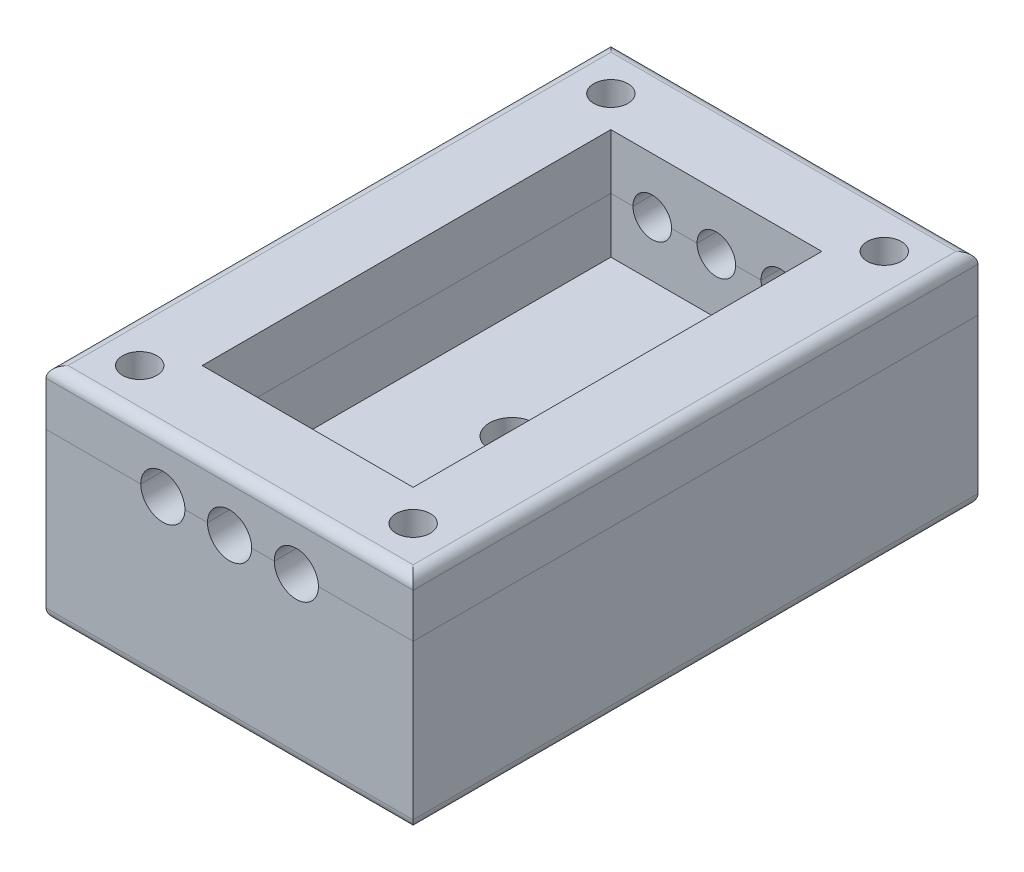
from build123d import *

# Parameters (mm, degrees)
BOSS_EXTRU_1_DEPTH           = 20
CONG_1_R                     = 0.5
CONG_2_R                     = 1
ESQUISSE3_W                  = 33.24213562373096
ESQUISSE3_H                  = 51.142135623730944
ESQUISSE3_R                  = 1.5499999999999992
ESQUISSE3_R_2                = 1.5499999999999898
ESQUISSE3_W_2                = 19.1
ESQUISSE3_H_2                = 37
BOSS_EXTRU_2_DEPTH           = 10
ESQUISSE3_3_W                = 33.24213562373096
ESQUISSE3_3_H                = 51.142135623730944
ESQUISSE3_3_R                = 1.5499999999999992
ESQUISSE3_3_R_2              = 1.5499999999999898
ESQUISSE3_3_W_2              = 19.1
ESQUISSE3_3_H_2              = 37
BOSS_EXTRU_4_DEPTH           = 20
TROUS_MOTEUR_REACH           = 57.899
ESQUISSE8_R                  = 1.7500000000000038
ESQUISSE8_R_2                = 1.7500000000000027
ENL_V_MAT_EXTRU_1_DEPTH      = 50.47483724416424
TROUS_CABLES_PUISSANCE_REACH = 57.899
ESQUISSE9_R                  = 2
ESQUISSE9_R_2                = 2.000000000000005
ESQUISSE9_R_3                = 2.0000000000000053
ENL_V_MAT_EXTRU_4_REACH      = 42.946
ESQUISSE10_R                 = 2.05
CONG_3_R                     = 1
FRACTIONNER1_SURFACE_1_BACK  = 65.715
FRACTIONNER1_SURFACE_1_DEPTH = 131.43
FRACTIONNER1_SURFACE_2_BACK  = 65.715
FRACTIONNER1_SURFACE_2_DEPTH = 131.43


with BuildPart() as part:
    # Esquisse1 → Boss.-Extru.1 (new body)
    with BuildSketch(Plane.XY):
        Polygon((-1.176e-14, 10.103135382441117), (-2.578e-14, 4.840000000000001), (3.5, 4.840000000000001), (5.71, 6.983135382441116), (5.71, 8.483135382441116), (2.95, 8.483135382441116), (2.95, 10.103135382441117), align=None)
        Polygon((-3.5, 4.840000000000001), (-2.576e-14, 4.840000000000001), (-1.176e-14, 10.103135382441117), (-2.95, 10.103135382441117), (-2.95, 8.483135382441116), (-5.71, 8.483135382441116), (-5.71, 6.983135382441116), align=None)
    extrude(amount=-BOSS_EXTRU_1_DEPTH)

    # Congé1
    cong_1_edges = [part.edges().sort_by_distance(p)[0] for p in [
        (5.71, 7.733135382441116, 0),
        (4.605, 5.911567691220558, 0),
        (0, 4.840000000000001, 0),
        (-4.605, 5.911567691220558, 0),
        (-5.71, 7.733135382441116, 0),
        (-5.71, 7.733135382441116, -20),
        (-4.605, 5.911567691220558, -20),
        (0, 4.840000000000001, -20),
        (4.605, 5.911567691220558, -20),
        (5.71, 7.733135382441116, -20),
    ]]
    fillet(cong_1_edges, radius=CONG_1_R)

    # Congé2
    # the kernel refuses this fillet: 1 mm, written as the material it takes off along each edge
    with BuildSketch(Plane(origin=(4.71, 7.4063748668930085, -20), x_dir=(1, 0, 0), z_dir=(0, 1, 0))) as cong_2_piece_1:
        with BuildLine():
            CenterArc((0.5, -0.5), 0.5, 0, 90)
            Line((1, -0.5), (1, 0))
            Line((1, 0), (0.5, 0))
        make_face()
    revolve(axis=Axis((4.71, 7.4063748668930085, -20), (0, 0, -1)), revolution_arc=45.87999999999987, mode=Mode.SUBTRACT)
    with BuildSketch(Plane(origin=(-4.710000000000001, 7.40637486689301, -20), x_dir=(-0.6961634275566162, -0.717883334625219, 0), z_dir=(0.717883334625219, -0.6961634275566162, 0))) as cong_2_piece_2:
        with BuildLine():
            CenterArc((0.5, -0.5), 0.5, 0, 90)
            Line((1, -0.5), (1, 0))
            Line((1, 0), (0.5, 0))
        make_face()
    revolve(axis=Axis((-4.710000000000001, 7.40637486689301, -20), (0, 0, -1)), revolution_arc=45.87999999999987, mode=Mode.SUBTRACT)
    with BuildSketch(Plane(origin=(4.71, 7.4063748668930085, 0), x_dir=(0.6961634275566162, -0.717883334625219, 0), z_dir=(-0.717883334625219, -0.6961634275566162, 0))) as cong_2_piece_3:
        with BuildLine():
            CenterArc((0.5, -0.5), 0.5, 0, 90)
            Line((1, -0.5), (1, 0))
            Line((1, 0), (0.5, 0))
        make_face()
    revolve(axis=Axis((4.71, 7.4063748668930085, 0), (0, 0, 1)), revolution_arc=45.87999999999987, mode=Mode.SUBTRACT)
    with BuildSketch(Plane(origin=(-4.710000000000001, 7.40637486689301, 0), x_dir=(-1, 0, 0), z_dir=(0, 1, 0))) as cong_2_piece_4:
        with BuildLine():
            CenterArc((0.5, -0.5), 0.5, 0, 90)
            Line((1, -0.5), (1, 0))
            Line((1, 0), (0.5, 0))
        make_face()
    revolve(axis=Axis((-4.710000000000001, 7.40637486689301, 0), (0, 0, 1)), revolution_arc=45.87999999999987, mode=Mode.SUBTRACT)
    with BuildSketch(Plane(origin=(-5.71, 6.983135382441116, 1.1e-16), x_dir=(0.717883334625219, -0.6961634275566161, 0), z_dir=(0, 0, -1))) as cong_2_piece_5:
        with BuildLine():
            CenterArc((CONG_2_R * 0.423239484452, -CONG_2_R), CONG_2_R, 90.00000000000003, 45.879999999999825)
            Line((-CONG_2_R * 0.294643850173, -CONG_2_R * 0.303836572443), (0, 0))
            Line((0, 0), (CONG_2_R * 0.423239484452, 0))
        make_face()
    extrude(amount=20, mode=Mode.SUBTRACT)
    with BuildSketch(Plane(origin=(5.71, 6.983135382441116, 1.1e-16), x_dir=(-0.7178833346252179, -0.6961634275566172, 0), z_dir=(0, 0, -1))) as cong_2_piece_6:
        with BuildLine():
            CenterArc((CONG_2_R * 0.423239484452, CONG_2_R), CONG_2_R, 224.12000000000015, 45.87999999999994)
            Line((-CONG_2_R * 0.294643850173, CONG_2_R * 0.303836572443), (0, 0))
            Line((0, 0), (CONG_2_R * 0.423239484452, 2e-17))
        make_face()
    extrude(amount=20, mode=Mode.SUBTRACT)

    # Esquisse3 → Boss.-Extru.2 (add)
    # profile 1 of 6: a face of its own
    with BuildSketch(Plane(origin=(0, 10.103135382441117, 0), x_dir=(1, 0, 0), z_dir=(0, 1, 0))):
        with Locations((1.78e-15, 9.999999999999996)):
            Rectangle(ESQUISSE3_W, ESQUISSE3_H)
        with Locations((12.37842712474619, -11.328427124746192)):
            Circle(ESQUISSE3_R, mode=Mode.SUBTRACT)
        with Locations((-12.37842712474619, -11.328427124746192)):
            Circle(ESQUISSE3_R, mode=Mode.SUBTRACT)
        with Locations((12.378427124746185, 31.328427124746177)):
            Circle(ESQUISSE3_R_2, mode=Mode.SUBTRACT)
        with Locations((-12.378427124746196, 31.328427124746177)):
            Circle(ESQUISSE3_R_2, mode=Mode.SUBTRACT)
        with Locations((1.78e-15, 10.000000000000004)):
            Rectangle(ESQUISSE3_W_2, ESQUISSE3_H_2, mode=Mode.SUBTRACT)
    # profile 2 of 6: a face of its own
    with BuildSketch(Plane(origin=(0, 10.103135382441117, 0), x_dir=(1, 0, 0), z_dir=(0, 1, 0))):
        with Locations((12.378427124746185, 31.328427124746177)):
            Circle(ESQUISSE3_R_2)
    # profile 3 of 6: a face of its own
    with BuildSketch(Plane(origin=(0, 10.103135382441117, 0), x_dir=(1, 0, 0), z_dir=(0, 1, 0))):
        with Locations((-12.378427124746196, 31.328427124746177)):
            Circle(ESQUISSE3_R_2)
    # profile 4 of 6: a face of its own
    with BuildSketch(Plane(origin=(0, 10.103135382441117, 0), x_dir=(1, 0, 0), z_dir=(0, 1, 0))):
        with Locations((-12.37842712474619, -11.328427124746192)):
            Circle(ESQUISSE3_R)
    # profile 5 of 6: a face of its own
    with BuildSketch(Plane(origin=(0, 10.103135382441117, 0), x_dir=(1, 0, 0), z_dir=(0, 1, 0))):
        with Locations((12.37842712474619, -11.328427124746192)):
            Circle(ESQUISSE3_R)
    # profile 6 of 6: a face of its own
    with BuildSketch(Plane(origin=(0, 10.103135382441117, 0), x_dir=(1, 0, 0), z_dir=(0, 1, 0))):
        Polygon((-9.549999999999999, 28.500000000000004), (-9.549999999999999, -8.499999999999996), (9.550000000000002, -8.499999999999998), (9.550000000000002, 28.500000000000004), align=None)
    extrude(amount=BOSS_EXTRU_2_DEPTH)

    # Esquisse3<3> → Boss.-Extru.4 (add)
    with BuildSketch(Plane(origin=(0, 10.103135382441117, 0), x_dir=(1, 0, 0), z_dir=(0, 1, 0))):
        with Locations((1.78e-15, 9.999999999999996)):
            Rectangle(ESQUISSE3_3_W, ESQUISSE3_3_H)
        with Locations(Location((-12.37842712474619, -11.328427124746192, 0), (0, 0, 270))):
            Circle(ESQUISSE3_3_R, mode=Mode.SUBTRACT)
        with Locations(Location((12.37842712474619, -11.328427124746192, 0), (0, 0, 90))):
            Circle(ESQUISSE3_3_R, mode=Mode.SUBTRACT)
        with Locations(Location((12.378427124746185, 31.328427124746177, 0), (0, 0, 270))):
            Circle(ESQUISSE3_3_R_2, mode=Mode.SUBTRACT)
        with Locations(Location((-12.378427124746196, 31.328427124746177, 0), (0, 0, 90))):
            Circle(ESQUISSE3_3_R_2, mode=Mode.SUBTRACT)
        with Locations((1.78e-15, 10.000000000000004)):
            Rectangle(ESQUISSE3_3_W_2, ESQUISSE3_3_H_2, mode=Mode.SUBTRACT)
    extrude(amount=BOSS_EXTRU_4_DEPTH)

    # Esquisse8 → Trous_moteur (cut, up to next)
    with BuildSketch(Plane.XY.offset(-28.500000000000004), mode=Mode.PRIVATE) as trous_moteur_sk1:
        with Locations((5.800000000000003, 25.10313538244111)):
            Circle(ESQUISSE8_R)
    trous_moteur_tool1 = extrude(trous_moteur_sk1.sketch, amount=-TROUS_MOTEUR_REACH, mode=Mode.PRIVATE) & part.part
    # Esquisse8 → Trous_moteur (cut, up to next)
    with BuildSketch(Plane.XY.offset(-28.500000000000004), mode=Mode.PRIVATE) as trous_moteur_sk2:
        with Locations((3.47e-15, 25.103135382441113)):
            Circle(ESQUISSE8_R_2)
    trous_moteur_tool2 = extrude(trous_moteur_sk2.sketch, amount=-TROUS_MOTEUR_REACH, mode=Mode.PRIVATE) & part.part
    # Esquisse8 → Trous_moteur (cut, up to next)
    with BuildSketch(Plane.XY.offset(-28.500000000000004), mode=Mode.PRIVATE) as trous_moteur_sk3:
        with Locations((-5.799999999999996, 25.103135382441117)):
            Circle(ESQUISSE8_R)
    trous_moteur_tool3 = extrude(trous_moteur_sk3.sketch, amount=-TROUS_MOTEUR_REACH, mode=Mode.PRIVATE) & part.part
    add(trous_moteur_tool1.solids().sort_by_distance((5.8, 25.103135, -28.5))[0], mode=Mode.SUBTRACT)
    add(trous_moteur_tool2.solids().sort_by_distance((0, 25.103135, -28.5))[0], mode=Mode.SUBTRACT)
    add(trous_moteur_tool3.solids().sort_by_distance((-5.8, 25.103135, -28.5))[0], mode=Mode.SUBTRACT)

    # Esquisse5 → Enlèv. mat.-Extru.1 (cut, through all)
    with BuildSketch(Plane.XY):
        with BuildLine():
            Line((-5.209999999999999, 8.483135382441116), (-5.71, 8.483135382441116))
            Line((-5.71, 8.483135382441116), (-5.71, 7.4063748668930085))
            ThreePointArc((-5.71, 7.4063748668930085), (-5.630913521335368, 7.01660790289825), (-5.406163427556616, 6.68849153226779))
            Line((-5.406163427556616, 6.68849153226779), (-3.5, 4.840000000000001))
            Line((-3.5, 4.840000000000001), (3.5, 4.840000000000001))
            Line((3.5, 4.840000000000001), (5.406163427556617, 6.68849153226779))
            ThreePointArc((5.406163427556617, 6.68849153226779), (5.630913521335369, 7.01660790289825), (5.71, 7.406374866893009))
            Line((5.71, 7.406374866893009), (5.71, 8.483135382441116))
            Line((5.71, 8.483135382441116), (5.209999999999999, 8.483135382441116))
            Line((5.209999999999999, 8.483135382441116), (2.95, 8.483135382441116))
            Line((2.95, 8.483135382441116), (-2.95, 8.483135382441116))
            Line((-2.95, 8.483135382441116), (-5.209999999999999, 8.483135382441116))
        make_face()
    extrude(amount=-ENL_V_MAT_EXTRU_1_DEPTH, mode=Mode.SUBTRACT)

    # Esquisse9 → Trous_cables_puissance (cut, up to next)
    with BuildSketch(Plane(origin=(0, 0, 8.499999999999998), x_dir=(-1, 0, 0), z_dir=(0, 0, -1)), mode=Mode.PRIVATE) as trous_cables_puissance_sk1:
        with Locations((6.044999999999998, 25.103135382441117)):
            Circle(ESQUISSE9_R)
    trous_cables_puissance_tool1 = extrude(trous_cables_puissance_sk1.sketch, amount=-TROUS_CABLES_PUISSANCE_REACH, mode=Mode.PRIVATE) & part.part
    # Esquisse9 → Trous_cables_puissance (cut, up to next)
    with BuildSketch(Plane(origin=(0, 0, 8.499999999999998), x_dir=(-1, 0, 0), z_dir=(0, 0, -1)), mode=Mode.PRIVATE) as trous_cables_puissance_sk2:
        with Locations((-6.045000000000002, 25.103135382441117)):
            Circle(ESQUISSE9_R_2)
    trous_cables_puissance_tool2 = extrude(trous_cables_puissance_sk2.sketch, amount=-TROUS_CABLES_PUISSANCE_REACH, mode=Mode.PRIVATE) & part.part
    # Esquisse9 → Trous_cables_puissance (cut, up to next)
    with BuildSketch(Plane(origin=(0, 0, 8.499999999999998), x_dir=(-1, 0, 0), z_dir=(0, 0, -1)), mode=Mode.PRIVATE) as trous_cables_puissance_sk3:
        with Locations((-1.73e-15, 25.103135382441117)):
            Circle(ESQUISSE9_R_3)
    trous_cables_puissance_tool3 = extrude(trous_cables_puissance_sk3.sketch, amount=-TROUS_CABLES_PUISSANCE_REACH, mode=Mode.PRIVATE) & part.part
    add(trous_cables_puissance_tool1.solids().sort_by_distance((-6.045, 25.103135, 8.5))[0], mode=Mode.SUBTRACT)
    add(trous_cables_puissance_tool2.solids().sort_by_distance((6.045, 25.103135, 8.5))[0], mode=Mode.SUBTRACT)
    add(trous_cables_puissance_tool3.solids().sort_by_distance((0, 25.103135, 8.5))[0], mode=Mode.SUBTRACT)

    # Esquisse10 → Enlèv. mat.-Extru.4 (cut, up to next)
    with BuildSketch(Plane(origin=(0, 20.103135382441113, 0), x_dir=(1, 0, 0), z_dir=(0, 1, 0)), mode=Mode.PRIVATE) as enl_v_mat_extru_4_sk1:
        with Locations(Location((1.73e-15, 10.000000000000004, 0), (0, 0, 270))):
            Circle(ESQUISSE10_R)
    enl_v_mat_extru_4_tool1 = extrude(enl_v_mat_extru_4_sk1.sketch, amount=-ENL_V_MAT_EXTRU_4_REACH, mode=Mode.PRIVATE) & part.part
    add(enl_v_mat_extru_4_tool1.solids().sort_by_distance((0, 20.103135, -10))[0], mode=Mode.SUBTRACT)

    # Congé3
    cong_3_edges = [part.edges().sort_by_distance(p)[0] for p in [
        (16.62106781186548, 10.103135382441117, -9.999999999999996),
        (3.55e-15, 10.103135382441117, -35.57106781186547),
        (-16.621067811865476, 10.103135382441117, -9.999999999999996),
        (0, 10.103135382441117, 15.571067811865476),
        (16.62106781186548, 30.103135382441117, -9.999999999999996),
        (3.55e-15, 30.103135382441117, -35.57106781186547),
        (-16.621067811865476, 30.103135382441117, -9.999999999999996),
        (0, 30.103135382441117, 15.571067811865476),
    ]]
    fillet(cong_3_edges, radius=CONG_3_R)


with BuildPart() as body_2:
    # Fractionner1: the piece behind the surface
    add(part.part)
    # Fractionner1 surface: a surface, the sketch's curves swept straight by 131.43 mm
    with BuildLine(Plane.XY.offset(15.571067811865476).offset(-FRACTIONNER1_SURFACE_1_BACK), mode=Mode.PRIVATE) as fractionner1_surface_1_path:
        Line((16.62106781186548, 29.103135382441117), (16.62106781186548, 25.103135382441113))
        Line((16.62106781186548, 25.103135382441113), (-16.62106781186548, 25.10313538244112))
        Line((-16.62106781186548, 25.10313538244112), (-16.621067811865476, 29.103135382441117))
        ThreePointArc((-16.621067811865476, 29.103135382441117), (-16.328174593052022, 29.810242163627663), (-15.621067811865476, 30.103135382441117))
        Line((-15.621067811865476, 30.103135382441117), (15.62106781186548, 30.103135382441117))
        ThreePointArc((15.62106781186548, 30.103135382441117), (16.328174593052026, 29.810242163627663), (16.62106781186548, 29.103135382441117))
    fractionner1_surface_1 = Shell.extrude(fractionner1_surface_1_path.wire(), (0 * FRACTIONNER1_SURFACE_1_DEPTH, 0 * FRACTIONNER1_SURFACE_1_DEPTH, 1 * FRACTIONNER1_SURFACE_1_DEPTH))
    split(bisect_by=fractionner1_surface_1, keep=Keep.BOTTOM)


with BuildPart() as part_1:
    add(part.part)

    # Fractionner1: split by a surface, the side it looks to stays
    # Fractionner1 surface: a surface, the sketch's curves swept straight by 131.43 mm
    with BuildLine(Plane.XY.offset(15.571067811865476).offset(-FRACTIONNER1_SURFACE_2_BACK), mode=Mode.PRIVATE) as fractionner1_surface_2_path:
        Line((16.62106781186548, 29.103135382441117), (16.62106781186548, 25.103135382441113))
        Line((16.62106781186548, 25.103135382441113), (-16.62106781186548, 25.10313538244112))
        Line((-16.62106781186548, 25.10313538244112), (-16.621067811865476, 29.103135382441117))
        ThreePointArc((-16.621067811865476, 29.103135382441117), (-16.328174593052022, 29.810242163627663), (-15.621067811865476, 30.103135382441117))
        Line((-15.621067811865476, 30.103135382441117), (15.62106781186548, 30.103135382441117))
        ThreePointArc((15.62106781186548, 30.103135382441117), (16.328174593052026, 29.810242163627663), (16.62106781186548, 29.103135382441117))
    fractionner1_surface_2 = Shell.extrude(fractionner1_surface_2_path.wire(), (0 * FRACTIONNER1_SURFACE_2_DEPTH, 0 * FRACTIONNER1_SURFACE_2_DEPTH, 1 * FRACTIONNER1_SURFACE_2_DEPTH))
    split(bisect_by=fractionner1_surface_2, keep=Keep.TOP)


solid = Compound([body_2.part, part_1.part])
